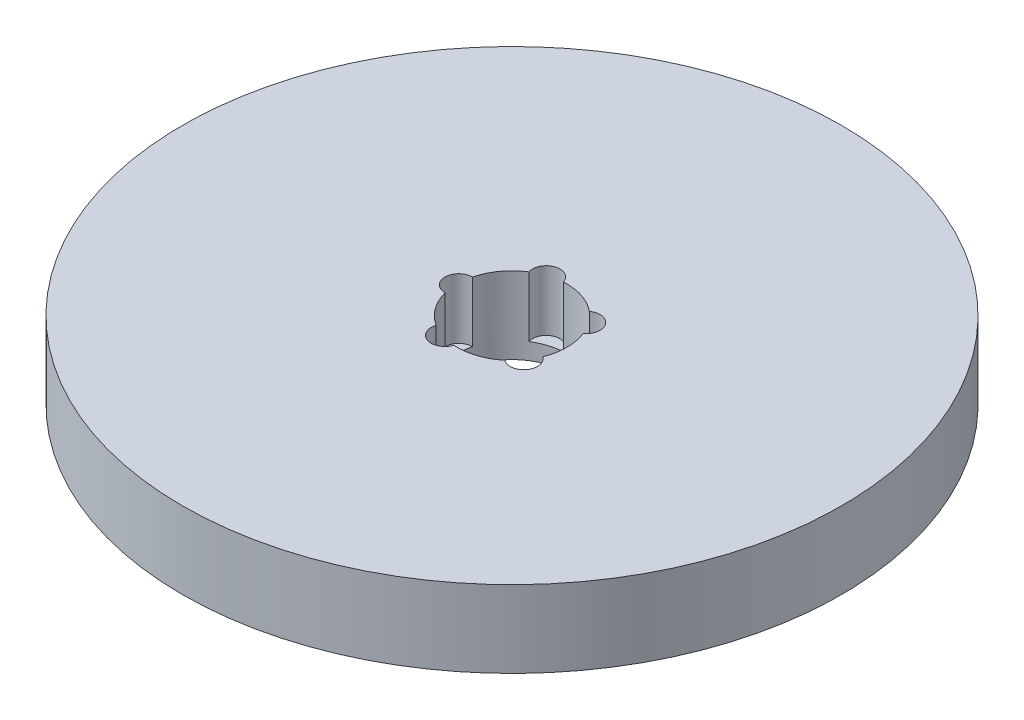
from build123d import *

# Parameters (mm, degrees)
SKETCH1_R           = 90
BOSS_EXTRUDE1_DEPTH = 21
SKETCH2_R           = 15
CUT_EXTRUDE1_DEPTH  = 130
SKETCH3_R           = 3.733831239
CUT_EXTRUDE2_DEPTH  = 16.487254779
CIRPATTERN1_COUNT   = 5


with BuildPart() as part:
    # Sketch1 → Boss-Extrude1 (new body)
    with BuildSketch(Plane(origin=(0, 0, 0), x_dir=(1, 0, 0), z_dir=(0, 1, 0))):
        Circle(SKETCH1_R)
    extrude(amount=BOSS_EXTRUDE1_DEPTH)

    # Sketch2 → Cut-Extrude1 (cut, through all)
    with BuildSketch(Plane(origin=(0, 0, 0), x_dir=(1, 0, 0), z_dir=(0, 1, 0))):
        Circle(SKETCH2_R)
    extrude(amount=CUT_EXTRUDE1_DEPTH, mode=Mode.SUBTRACT)

    # Sketch3 → Cut-Extrude2 (cut)
    with BuildSketch(Plane(origin=(0, 21, 0), x_dir=(1, 0, 0), z_dir=(0, 1, 0))):
        with Locations((-14.55006149, 0)):
            Circle(SKETCH3_R)
    cut_extrude2 = extrude(amount=-CUT_EXTRUDE2_DEPTH, mode=Mode.SUBTRACT)

    # CirPattern1: Cut-Extrude2 ×5 about axis
    cirpattern1_axis = Axis((0, 0, 0), (0, 1, 0))
    for i in range(1, CIRPATTERN1_COUNT):
        add(cut_extrude2.rotate(cirpattern1_axis, i * 360 / CIRPATTERN1_COUNT), mode=Mode.SUBTRACT)


solid = part.part
